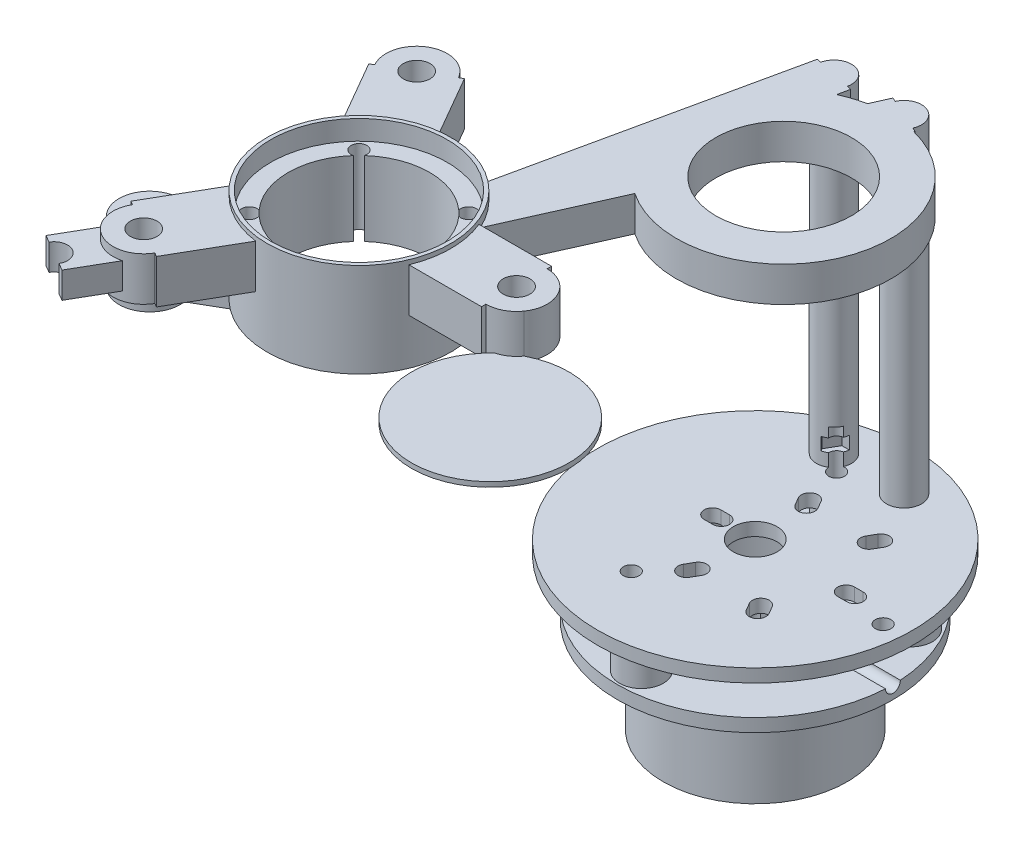
from build123d import *
from build123d.topology import SkipClean

# Parameters (mm, degrees)
CARRIER_INBOARD_FRAME_SKETCH_R              = 15.5
CARRIER_INBOARD_FRAME_SKETCH_R_2            = 3.050000001
CARRIER_INBOARD_FRAME_SKETCH_R_3            = 3.050000002
CARRIER_INBOARD_FRAME_SKETCH_R_4            = 3.049999999
CARRIER_INBOARD_FRAME_DEPTH                 = 4.5
CARRIER_START                               = -0.9
CARRIER_GUIDE_AND_PIVOT_FRAME_2_SKETCH_R    = 15.5
CARRIER_GUIDE_AND_PIVOT_FRAME_2_SKETCH_R_2  = 3.050000001
CARRIER_GUIDE_AND_PIVOT_FRAME_2_SKETCH_R_3  = 3.050000002
CARRIER_GUIDE_AND_PIVOT_FRAME_2_SKETCH_R_4  = 3.049999999
CARRIER_GUIDE_AND_PIVOT_FRAME_2_DEPTH       = 0.9
CARRIER_START_2                             = -0.1
CARRIER_GUIDE_AND_PIVOT_FRAME_3_SKETCH_R    = 15.5
CARRIER_GUIDE_AND_PIVOT_FRAME_3_SKETCH_R_2  = 3.050000001
CARRIER_GUIDE_AND_PIVOT_FRAME_3_SKETCH_R_3  = 3.050000002
CARRIER_GUIDE_AND_PIVOT_FRAME_3_SKETCH_R_4  = 3.049999999
CARRIER_GUIDE_AND_PIVOT_FRAME_3_DEPTH       = 0.1
CARRIER_START_3                             = -0.999999998
CARRIER_GUIDE_AND_PIVOT_FRAME_4_SKETCH_R    = 4
CARRIER_GUIDE_AND_PIVOT_FRAME_4_SKETCH_R_2  = 3.050000001
CARRIER_GUIDE_AND_PIVOT_FRAME_4_SKETCH_R_3  = 3.050000002
CARRIER_GUIDE_AND_PIVOT_FRAME_4_SKETCH_R_4  = 3.049999999
CARRIER_GUIDE_AND_PIVOT_FRAME_4_DEPTH       = 0.999999998
CARRIER_START_4                             = -0.010000002
CARRIER_GUIDE_AND_PIVOT_FRAME_5_SKETCH_R    = 4
CARRIER_GUIDE_AND_PIVOT_FRAME_5_SKETCH_R_2  = 21
CARRIER_GUIDE_AND_PIVOT_FRAME_5_SKETCH_R_3  = 18.000000001
CARRIER_GUIDE_AND_PIVOT_FRAME_5_DEPTH       = 0.010000002
CARRIER_START_5                             = -0.490000001
CARRIER_GUIDE_AND_PIVOT_FRAME_6_SKETCH_R    = 4
CARRIER_GUIDE_AND_PIVOT_FRAME_6_SKETCH_R_2  = 21
CARRIER_GUIDE_AND_PIVOT_FRAME_6_DEPTH       = 0.490000001
CARRIER_START_6                             = -2.999999998
CARRIER_GUIDE_AND_PIVOT_FRAME_7_SKETCH_R    = 4
CARRIER_GUIDE_AND_PIVOT_FRAME_7_SKETCH_R_2  = 21
CARRIER_GUIDE_AND_PIVOT_FRAME_7_SKETCH_R_3  = 3.1
CARRIER_GUIDE_AND_PIVOT_FRAME_7_DEPTH       = 2.999999998
CARRIER_GUIDE_AND_PIVOT_FRAME_8_SKETCH_R    = 4
CARRIER_GUIDE_AND_PIVOT_FRAME_8_SKETCH_R_2  = 21
CARRIER_GUIDE_AND_PIVOT_FRAME_8_DEPTH       = 2.500000001
CARRIER_GUIDE_AND_PIVOT_FRAME_9_SKETCH_R    = 4
CARRIER_GUIDE_AND_PIVOT_FRAME_9_DEPTH       = 4.5
CARRIER_GUIDE_AND_PIVOT_FRAME_10_SKETCH_R   = 4
CARRIER_GUIDE_AND_PIVOT_FRAME_10_DEPTH      = 1.000000001
CARRIER_GUIDE_AND_PIVOT_FRAME_11_SKETCH_R   = 4
CARRIER_GUIDE_AND_PIVOT_FRAME_11_SKETCH_R_2 = 3.1
CARRIER_GUIDE_AND_PIVOT_FRAME_11_DEPTH      = 0.5
CARRIER_GUIDE_AND_PIVOT_FRAME_12_SKETCH_R   = 4
CARRIER_GUIDE_AND_PIVOT_FRAME_12_SKETCH_R_2 = 3.1
CARRIER_GUIDE_AND_PIVOT_FRAME_12_DEPTH      = 2.499999999
CARRIER_WHEEL_SUPPORT_13_SKETCH_R           = 4
CARRIER_WHEEL_SUPPORT_13_DEPTH              = 43.5
CARRIER_WHEEL_SUPPORT_14_SKETCH_R           = 4
CARRIER_WHEEL_SUPPORT_14_DEPTH              = 2.2
CARRIER_WHEEL_SUPPORT_15_SKETCH_R           = 4
CARRIER_WHEEL_SUPPORT_15_DEPTH              = 2.9
CARRIER_WHEEL_SUPPORT_16_SKETCH_R           = 4
CARRIER_WHEEL_SUPPORT_16_DEPTH              = 2.9
CARRIER_WHEEL_SUPPORT_17_SKETCH_R           = 36
CARRIER_WHEEL_SUPPORT_17_SKETCH_R_2         = 1.8
CARRIER_WHEEL_SUPPORT_17_SKETCH_R_3         = 5
CARRIER_WHEEL_SUPPORT_17_DEPTH              = 3
CARRIER_WHEEL_SUPPORT_18_SKETCH_R           = 5
CARRIER_WHEEL_SUPPORT_18_SKETCH_R_2         = 4
CARRIER_WHEEL_SUPPORT_18_DEPTH              = 0.9
CARRIER_WHEEL_SUPPORT_19_SKETCH_R           = 5
CARRIER_WHEEL_SUPPORT_19_SKETCH_R_2         = 4
CARRIER_WHEEL_SUPPORT_19_DEPTH              = 1.5
CARRIER_WHEEL_SUPPORT_20_SKETCH_R           = 5
CARRIER_WHEEL_SUPPORT_20_SKETCH_R_2         = 4
CARRIER_WHEEL_SUPPORT_20_DEPTH              = 7.600000002
CARRIER_WHEEL_SUPPORT_21_SKETCH_R           = 31.5
CARRIER_WHEEL_SUPPORT_21_SKETCH_R_2         = 20.15
CARRIER_WHEEL_SUPPORT_21_DEPTH              = 2.999999998
CARRIER_WHEEL_SUPPORT_22_SKETCH_R           = 21
CARRIER_WHEEL_SUPPORT_22_SKETCH_R_2         = 20.15
CARRIER_WHEEL_SUPPORT_22_DEPTH              = 4.5
CARRIER_WHEEL_SUPPORT_23_SKETCH_R           = 21
CARRIER_WHEEL_SUPPORT_23_DEPTH              = 17
CARRIER_GUIDE_AND_PIVOT_FRAME_24_SKETCH_R   = 15.500000001
CARRIER_GUIDE_AND_PIVOT_FRAME_24_SKETCH_R_2 = 20.150000001
CARRIER_GUIDE_AND_PIVOT_FRAME_24_SKETCH_R_3 = 3.05
CARRIER_GUIDE_AND_PIVOT_FRAME_24_SKETCH_R_4 = 3.050000003
CARRIER_GUIDE_AND_PIVOT_FRAME_24_DEPTH      = 1.499999999
CARRIER_GUIDE_AND_PIVOT_FRAME_25_SKETCH_R   = 15.500000001
CARRIER_GUIDE_AND_PIVOT_FRAME_25_SKETCH_R_2 = 20.150000001
CARRIER_GUIDE_AND_PIVOT_FRAME_25_SKETCH_R_3 = 3.05
CARRIER_GUIDE_AND_PIVOT_FRAME_25_SKETCH_R_4 = 3.050000003
CARRIER_GUIDE_AND_PIVOT_FRAME_25_DEPTH      = 0.999999996
CARRIER_GUIDE_AND_PIVOT_FRAME_26_SKETCH_R   = 20.150000001
CARRIER_GUIDE_AND_PIVOT_FRAME_26_SKETCH_R_2 = 3.05
CARRIER_GUIDE_AND_PIVOT_FRAME_26_SKETCH_R_3 = 3.050000003
CARRIER_GUIDE_AND_PIVOT_FRAME_26_DEPTH      = 1.000000006
CARRIER_GUIDE_AND_PIVOT_FRAME_27_SKETCH_R   = 21
CARRIER_GUIDE_AND_PIVOT_FRAME_27_SKETCH_R_2 = 20.15
CARRIER_GUIDE_AND_PIVOT_FRAME_27_DEPTH      = 0.999999998
COUPLING_PIN_SERVICE_CHANNEL_SKETCH_R       = 1.7
COUPLING_PIN_SERVICE_CHANNEL_DEPTH          = 66


with BuildPart() as part:
    # Carrier Inboard Frame Sketch → Carrier Inboard Frame (new body)
    with BuildSketch(Plane(origin=(0, -132, 0), x_dir=(1, 0, 0), z_dir=(0, 1, 0))):
        with BuildLine():
            Line((-23.100614252, 78.394535152), (-22.123472094, 78.181948221))
            Line((-22.123472094, 78.181948221), (-22.701719693, 75.524070327))
            ThreePointArc((-22.701719693, 75.524070327), (-20.084271186, 76.544411569), (-17.367224839, 77.258408824))
            Line((-17.367224839, 77.258408824), (-15.576730603, 81.278969365))
            Line((-15.576730603, 81.278969365), (-14.663221052, 80.872152065))
            ThreePointArc((-14.663221052, 80.872152065), (-12.020207409, 83.115002954), (-8.617920583, 82.451417558))
            ThreePointArc((-8.617920583, 82.451417558), (-7.1390628, 80.255907409), (-7.355144702, 77.617613686))
            Line((-7.355144702, 77.617613686), (-6.441635164, 77.210796392))
            Line((-6.441635164, 77.210796392), (-6.533321658, 77.004914078))
            ThreePointArc((-6.533321658, 77.004914078), (9.87180094, 43.277859095), (-26.171286763, 32.907800552))
            Line((-26.171286763, 32.907800552), (-37.06497245, 8.445994462))
            ThreePointArc((-37.06497245, 8.445994462), (-36.968781126, 8.223544876), (-36.875163407, 8))
            Line((-36.875163407, 8), (-20.291651247, 8))
            Line((-20.291651247, 8), (-20.291651247, 7))
            ThreePointArc((-20.291651247, 7), (-14.084717769, 3.236352392), (-14.552272959, -4.007435199))
            Line((-14.552272959, -4.007435199), (-14.566573894, -4.027839286))
            ThreePointArc((-14.566573894, -4.027839286), (-17.066350873, -6.212683599), (-20.291651246, -7))
            Line((-20.291651246, -7), (-20.291651246, -8))
            Line((-20.291651246, -8), (-36.875163407, -8))
            ThreePointArc((-36.875163407, -8), (-44.6083298, -17.449928367), (-56.291651246, -21))
            ThreePointArc((-56.291651246, -21), (-57.684740236, -20.953741982), (-59.071691937, -20.815171721))
            Line((-59.071691937, -20.815171721), (-67.363448017, -35.176914536))
            Line((-67.363448017, -35.176914536), (-68.229473419, -34.676914537))
            ThreePointArc((-68.229473419, -34.676914537), (-70.002040821, -36.708572734), (-72.411013969, -37.919555224))
            Line((-72.411013969, -37.919555224), (-77.461524226, -46.667295594))
            Line((-77.461524226, -46.667295594), (-79.106972494, -45.717295594))
            ThreePointArc((-79.106972494, -45.717295594), (-80.241651245, -41.482616842), (-84.476329997, -42.617295594))
            Line((-84.476329997, -42.617295594), (-86.121778264, -41.667295594))
            Line((-86.121778264, -41.667295594), (-81.071268007, -32.919555224))
            ThreePointArc((-81.071268007, -32.919555224), (-81.227012981, -30.227832035), (-80.353829072, -27.676914537))
            Line((-80.353829072, -27.676914537), (-81.219854478, -27.176914536))
            Line((-81.219854478, -27.176914536), (-72.928098397, -12.815171719))
            ThreePointArc((-72.928098397, -12.815171719), (-77.291651246, 0), (-72.928098397, 12.815171719))
            Line((-72.928098397, 12.815171719), (-81.219854478, 27.176914536))
            Line((-81.219854478, 27.176914536), (-80.353829074, 27.676914536))
            ThreePointArc((-80.353829074, 27.676914536), (-77.791651247, 37.239092362), (-68.229473421, 34.676914535))
            Line((-68.229473421, 34.676914535), (-67.363448018, 35.176914535))
            Line((-67.363448018, 35.176914535), (-59.071691938, 20.81517172))
            ThreePointArc((-59.071691938, 20.81517172), (-52.021603008, 20.561291011), (-45.453402184, 17.987005233))
            Line((-45.453402184, 17.987005233), (-31.894893673, 80.307817537))
            Line((-31.894893673, 80.307817537), (-30.917751515, 80.095230605))
            ThreePointArc((-30.917751515, 80.095230605), (-29.450257235, 82.413661194), (-26.834136801, 83.241050902))
            ThreePointArc((-26.834136801, 83.241050902), (-23.840404568, 81.685957231), (-23.100614252, 78.394535152))
        make_face()
        with Locations((-12.509182883, 53.244882879)):
            Circle(CARRIER_INBOARD_FRAME_SKETCH_R, mode=Mode.SUBTRACT)
        with Locations((-20.291651247, 0)):
            Circle(CARRIER_INBOARD_FRAME_SKETCH_R_2, mode=Mode.SUBTRACT)
        with Locations((-74.291651248, 31.176914536)):
            Circle(CARRIER_INBOARD_FRAME_SKETCH_R_3, mode=Mode.SUBTRACT)
        with Locations((-74.291651245, -31.176914537)):
            Circle(CARRIER_INBOARD_FRAME_SKETCH_R_4, mode=Mode.SUBTRACT)
        with BuildLine():
            ThreePointArc((-68.31259652, -10.785146023), (-70.080233479, -13.788582233), (-67.076797269, -12.020945274))
            ThreePointArc((-67.076797269, -12.020945274), (-56.291651246, -16.15), (-45.506505223, -12.020945274))
            ThreePointArc((-45.506505223, -12.020945274), (-42.503069013, -13.788582233), (-44.270705972, -10.785146023))
            ThreePointArc((-44.270705972, -10.785146023), (-40.141651246, 0), (-44.270705972, 10.785146023))
            ThreePointArc((-44.270705972, 10.785146023), (-42.503069013, 13.788582233), (-45.506505223, 12.020945274))
            ThreePointArc((-45.506505223, 12.020945274), (-56.291651246, 16.15), (-67.076797269, 12.020945274))
            ThreePointArc((-67.076797269, 12.020945274), (-70.080233479, 13.788582233), (-68.31259652, 10.785146023))
            ThreePointArc((-68.31259652, 10.785146023), (-72.441651246, 0), (-68.31259652, -10.785146023))
        make_face(mode=Mode.SUBTRACT)
    extrude(amount=CARRIER_INBOARD_FRAME_DEPTH)

    # Carrier Guide and Pivot Frame 2 Sketch → Carrier Guide and Pivot Frame 2 (add)
    with BuildSketch(Plane(origin=(0, -132, 0), x_dir=(1, 0, 0), z_dir=(0, 1, 0)).offset(CARRIER_START)):
        with BuildLine():
            Line((-23.100614252, 78.394535152), (-22.123472094, 78.181948221))
            Line((-22.123472094, 78.181948221), (-22.701719693, 75.524070327))
            ThreePointArc((-22.701719693, 75.524070327), (-20.084271187, 76.544411569), (-17.367224839, 77.258408824))
            Line((-17.367224839, 77.258408824), (-15.576730603, 81.278969365))
            Line((-15.576730603, 81.278969365), (-14.663221052, 80.872152065))
            ThreePointArc((-14.663221052, 80.872152065), (-12.02020741, 83.115002954), (-8.617920583, 82.451417558))
            ThreePointArc((-8.617920583, 82.451417558), (-7.1390628, 80.255907409), (-7.355144702, 77.617613686))
            Line((-7.355144702, 77.617613686), (-6.441635164, 77.210796392))
            Line((-6.441635164, 77.210796392), (-6.533321658, 77.004914078))
            ThreePointArc((-6.533321658, 77.004914078), (9.87180094, 43.277859095), (-26.171286763, 32.907800552))
            Line((-26.171286763, 32.907800552), (-37.06497245, 8.445994462))
            ThreePointArc((-37.06497245, 8.445994462), (-36.968781126, 8.223544876), (-36.875163407, 8))
            Line((-36.875163407, 8), (-20.291651247, 8))
            Line((-20.291651247, 8), (-20.291651247, 7))
            ThreePointArc((-20.291651247, 7), (-14.084717769, 3.236352392), (-14.55227296, -4.007435199))
            Line((-14.55227296, -4.007435199), (-14.566573895, -4.027839286))
            ThreePointArc((-14.566573895, -4.027839286), (-17.066350873, -6.212683599), (-20.291651246, -7))
            Line((-20.291651246, -7), (-20.291651246, -8))
            Line((-20.291651246, -8), (-36.875163407, -8))
            ThreePointArc((-36.875163407, -8), (-44.6083298, -17.449928367), (-56.291651246, -21))
            ThreePointArc((-56.291651246, -21), (-57.684740236, -20.953741982), (-59.071691937, -20.815171721))
            Line((-59.071691937, -20.815171721), (-67.363448017, -35.176914536))
            Line((-67.363448017, -35.176914536), (-68.229473419, -34.676914537))
            ThreePointArc((-68.229473419, -34.676914537), (-70.002040821, -36.708572734), (-72.411013969, -37.919555224))
            ThreePointArc((-72.411013969, -37.919555224), (-79.823309442, -35.466524962), (-80.353829071, -27.676914537))
            Line((-80.353829071, -27.676914537), (-81.219854478, -27.176914536))
            Line((-81.219854478, -27.176914536), (-72.928098397, -12.815171719))
            ThreePointArc((-72.928098397, -12.815171719), (-77.291651246, 0), (-72.928098397, 12.815171719))
            Line((-72.928098397, 12.815171719), (-81.219854478, 27.176914536))
            Line((-81.219854478, 27.176914536), (-80.353829074, 27.676914536))
            ThreePointArc((-80.353829074, 27.676914536), (-77.791651247, 37.239092362), (-68.229473421, 34.676914536))
            Line((-68.229473421, 34.676914536), (-67.363448018, 35.176914535))
            Line((-67.363448018, 35.176914535), (-59.071691938, 20.81517172))
            ThreePointArc((-59.071691938, 20.81517172), (-52.021603008, 20.561291011), (-45.453402184, 17.987005233))
            Line((-45.453402184, 17.987005233), (-31.894893673, 80.307817537))
            Line((-31.894893673, 80.307817537), (-30.917751515, 80.095230605))
            ThreePointArc((-30.917751515, 80.095230605), (-29.450257235, 82.413661194), (-26.834136802, 83.241050902))
            ThreePointArc((-26.834136802, 83.241050902), (-23.840404569, 81.685957231), (-23.100614252, 78.394535152))
        make_face()
        with Locations((-12.509182883, 53.244882879)):
            Circle(CARRIER_GUIDE_AND_PIVOT_FRAME_2_SKETCH_R, mode=Mode.SUBTRACT)
        with Locations((-20.291651247, 0)):
            Circle(CARRIER_GUIDE_AND_PIVOT_FRAME_2_SKETCH_R_2, mode=Mode.SUBTRACT)
        with Locations((-74.291651248, 31.176914536)):
            Circle(CARRIER_GUIDE_AND_PIVOT_FRAME_2_SKETCH_R_3, mode=Mode.SUBTRACT)
        with Locations((-74.291651245, -31.176914537)):
            Circle(CARRIER_GUIDE_AND_PIVOT_FRAME_2_SKETCH_R_4, mode=Mode.SUBTRACT)
        with BuildLine():
            ThreePointArc((-68.31259652, -10.785146023), (-70.080233479, -13.788582233), (-67.076797269, -12.020945274))
            ThreePointArc((-67.076797269, -12.020945274), (-56.291651246, -16.15), (-45.506505223, -12.020945274))
            ThreePointArc((-45.506505223, -12.020945274), (-42.503069013, -13.788582233), (-44.270705972, -10.785146023))
            ThreePointArc((-44.270705972, -10.785146023), (-40.141651246, 0), (-44.270705972, 10.785146023))
            ThreePointArc((-44.270705972, 10.785146023), (-42.503069013, 13.788582233), (-45.506505223, 12.020945274))
            ThreePointArc((-45.506505223, 12.020945274), (-56.291651246, 16.15), (-67.076797269, 12.020945274))
            ThreePointArc((-67.076797269, 12.020945274), (-70.080233479, 13.788582233), (-68.31259652, 10.785146023))
            ThreePointArc((-68.31259652, 10.785146023), (-72.441651246, 0), (-68.31259652, -10.785146023))
        make_face(mode=Mode.SUBTRACT)
    extrude(amount=CARRIER_GUIDE_AND_PIVOT_FRAME_2_DEPTH)

    # Carrier Guide and Pivot Frame 3 Sketch → Carrier Guide and Pivot Frame 3 (add)
    with BuildSketch(Plane(origin=(0, -132.900000001, 0), x_dir=(1, 0, 0), z_dir=(0, 1, 0)).offset(CARRIER_START_2)):
        with BuildLine():
            Line((-23.100614253, 78.394535153), (-22.123472094, 78.181948221))
            Line((-22.123472094, 78.181948221), (-22.701719693, 75.524070327))
            ThreePointArc((-22.701719693, 75.524070327), (-20.084271187, 76.544411569), (-17.367224839, 77.258408824))
            Line((-17.367224839, 77.258408824), (-15.576730603, 81.278969365))
            Line((-15.576730603, 81.278969365), (-14.663221053, 80.872152065))
            ThreePointArc((-14.663221053, 80.872152065), (-12.02020741, 83.115002954), (-8.617920583, 82.451417558))
            ThreePointArc((-8.617920583, 82.451417558), (-7.1390628, 80.255907409), (-7.355144702, 77.617613686))
            Line((-7.355144702, 77.617613686), (-6.441635164, 77.210796392))
            Line((-6.441635164, 77.210796392), (-6.533321658, 77.004914078))
            ThreePointArc((-6.533321658, 77.004914078), (9.87180094, 43.277859095), (-26.171286763, 32.907800552))
            Line((-26.171286763, 32.907800552), (-37.06497245, 8.445994462))
            ThreePointArc((-37.06497245, 8.445994462), (-36.968781126, 8.223544876), (-36.875163407, 8))
            Line((-36.875163407, 8), (-20.291651247, 8))
            Line((-20.291651247, 8), (-20.291651247, 7))
            ThreePointArc((-20.291651247, 7), (-14.084717769, 3.236352392), (-14.55227296, -4.007435199))
            ThreePointArc((-14.55227296, -4.007435199), (4.030670954, -34.74617457), (-18.490761077, -6.764376882))
            ThreePointArc((-18.490761077, -6.764376882), (-19.383531808, -6.940844263), (-20.291651246, -7))
            Line((-20.291651246, -7), (-20.291651246, -8))
            Line((-20.291651246, -8), (-36.875163407, -8))
            ThreePointArc((-36.875163407, -8), (-44.6083298, -17.449928367), (-56.291651246, -21))
            ThreePointArc((-56.291651246, -21), (-57.684740236, -20.953741982), (-59.071691937, -20.815171721))
            Line((-59.071691937, -20.815171721), (-67.363448017, -35.176914536))
            Line((-67.363448017, -35.176914536), (-68.229473419, -34.676914537))
            ThreePointArc((-68.229473419, -34.676914537), (-70.002040821, -36.708572734), (-72.411013969, -37.919555224))
            ThreePointArc((-72.411013969, -37.919555224), (-79.823309442, -35.466524962), (-80.353829071, -27.676914537))
            Line((-80.353829071, -27.676914537), (-81.219854478, -27.176914536))
            Line((-81.219854478, -27.176914536), (-72.928098397, -12.815171719))
            ThreePointArc((-72.928098397, -12.815171719), (-77.291651246, 0), (-72.928098397, 12.815171719))
            Line((-72.928098397, 12.815171719), (-81.219854478, 27.176914536))
            Line((-81.219854478, 27.176914536), (-80.353829074, 27.676914536))
            ThreePointArc((-80.353829074, 27.676914536), (-77.791651247, 37.239092362), (-68.229473421, 34.676914536))
            Line((-68.229473421, 34.676914536), (-67.363448018, 35.176914535))
            Line((-67.363448018, 35.176914535), (-59.071691938, 20.81517172))
            ThreePointArc((-59.071691938, 20.81517172), (-52.021603008, 20.561291011), (-45.453402184, 17.987005233))
            Line((-45.453402184, 17.987005233), (-31.894893673, 80.307817537))
            Line((-31.894893673, 80.307817537), (-30.917751515, 80.095230605))
            ThreePointArc((-30.917751515, 80.095230605), (-29.450257235, 82.413661194), (-26.834136802, 83.241050902))
            ThreePointArc((-26.834136802, 83.241050902), (-23.840404569, 81.685957231), (-23.100614253, 78.394535153))
        make_face()
        with Locations((-12.509182883, 53.244882879)):
            Circle(CARRIER_GUIDE_AND_PIVOT_FRAME_3_SKETCH_R, mode=Mode.SUBTRACT)
        with Locations((-20.291651247, 0)):
            Circle(CARRIER_GUIDE_AND_PIVOT_FRAME_3_SKETCH_R_2, mode=Mode.SUBTRACT)
        with Locations((-74.291651248, 31.176914536)):
            Circle(CARRIER_GUIDE_AND_PIVOT_FRAME_3_SKETCH_R_3, mode=Mode.SUBTRACT)
        with Locations((-74.291651245, -31.176914537)):
            Circle(CARRIER_GUIDE_AND_PIVOT_FRAME_3_SKETCH_R_4, mode=Mode.SUBTRACT)
        with BuildLine():
            ThreePointArc((-68.31259652, -10.785146023), (-70.080233479, -13.788582233), (-67.076797269, -12.020945274))
            ThreePointArc((-67.076797269, -12.020945274), (-56.291651246, -16.15), (-45.506505223, -12.020945274))
            ThreePointArc((-45.506505223, -12.020945274), (-42.503069013, -13.788582233), (-44.270705972, -10.785146023))
            ThreePointArc((-44.270705972, -10.785146023), (-40.141651246, 0), (-44.270705972, 10.785146023))
            ThreePointArc((-44.270705972, 10.785146023), (-42.503069013, 13.788582233), (-45.506505223, 12.020945274))
            ThreePointArc((-45.506505223, 12.020945274), (-56.291651246, 16.15), (-67.076797269, 12.020945274))
            ThreePointArc((-67.076797269, 12.020945274), (-70.080233479, 13.788582233), (-68.31259652, 10.785146023))
            ThreePointArc((-68.31259652, 10.785146023), (-72.441651246, 0), (-68.31259652, -10.785146023))
        make_face(mode=Mode.SUBTRACT)
    extrude(amount=CARRIER_GUIDE_AND_PIVOT_FRAME_3_DEPTH)

    # Carrier Guide and Pivot Frame 4 Sketch → Carrier Guide and Pivot Frame 4 (add)
    # profile 1 of 3: a face of its own
    with BuildSketch(Plane(origin=(0, -133, 0), x_dir=(1, 0, 0), z_dir=(0, 1, 0)).offset(CARRIER_START_3)):
        with Locations((-27.009182884, 79.244882879)):
            Circle(CARRIER_GUIDE_AND_PIVOT_FRAME_4_SKETCH_R)
    # profile 2 of 3: a face of its own
    with BuildSketch(Plane(origin=(0, -133, 0), x_dir=(1, 0, 0), z_dir=(0, 1, 0)).offset(CARRIER_START_3)):
        with Locations((-11.009182876, 79.244882879)):
            Circle(CARRIER_GUIDE_AND_PIVOT_FRAME_4_SKETCH_R)
    # profile 3 of 3: a face of its own
    with BuildSketch(Plane(origin=(0, -133, 0), x_dir=(1, 0, 0), z_dir=(0, 1, 0)).offset(CARRIER_START_3)):
        with BuildLine():
            Line((-20.291651246, -8), (-36.875163407, -8))
            ThreePointArc((-36.875163407, -8), (-44.6083298, -17.449928367), (-56.291651246, -21))
            ThreePointArc((-56.291651246, -21), (-57.684740236, -20.953741982), (-59.071691937, -20.815171721))
            Line((-59.071691937, -20.815171721), (-67.363448017, -35.176914536))
            Line((-67.363448017, -35.176914536), (-68.229473419, -34.676914537))
            ThreePointArc((-68.229473419, -34.676914537), (-70.002040821, -36.708572734), (-72.411013969, -37.919555224))
            ThreePointArc((-72.411013969, -37.919555224), (-79.823309442, -35.466524962), (-80.353829071, -27.676914537))
            Line((-80.353829071, -27.676914537), (-81.219854478, -27.176914536))
            Line((-81.219854478, -27.176914536), (-72.928098397, -12.815171719))
            ThreePointArc((-72.928098397, -12.815171719), (-77.291651246, 0), (-72.928098397, 12.815171719))
            Line((-72.928098397, 12.815171719), (-81.219854478, 27.176914536))
            Line((-81.219854478, 27.176914536), (-80.353829074, 27.676914536))
            ThreePointArc((-80.353829074, 27.676914536), (-77.791651247, 37.239092362), (-68.229473421, 34.676914536))
            Line((-68.229473421, 34.676914536), (-67.363448018, 35.176914535))
            Line((-67.363448018, 35.176914535), (-59.071691938, 20.81517172))
            ThreePointArc((-59.071691938, 20.81517172), (-45.791651247, 18.18653348), (-36.875163407, 8))
            Line((-36.875163407, 8), (-20.291651247, 8))
            Line((-20.291651247, 8), (-20.291651247, 7))
            ThreePointArc((-20.291651247, 7), (-14.084717769, 3.236352392), (-14.55227296, -4.007435199))
            ThreePointArc((-14.55227296, -4.007435199), (4.030670954, -34.74617457), (-18.490761077, -6.764376882))
            ThreePointArc((-18.490761077, -6.764376882), (-19.383531808, -6.940844263), (-20.291651246, -7))
            Line((-20.291651246, -7), (-20.291651246, -8))
        make_face()
        with Locations((-20.291651247, 0)):
            Circle(CARRIER_GUIDE_AND_PIVOT_FRAME_4_SKETCH_R_2, mode=Mode.SUBTRACT)
        with Locations((-74.291651248, 31.176914536)):
            Circle(CARRIER_GUIDE_AND_PIVOT_FRAME_4_SKETCH_R_3, mode=Mode.SUBTRACT)
        with Locations((-74.291651245, -31.176914537)):
            Circle(CARRIER_GUIDE_AND_PIVOT_FRAME_4_SKETCH_R_4, mode=Mode.SUBTRACT)
        with BuildLine():
            ThreePointArc((-68.31259652, -10.785146023), (-70.080233479, -13.788582233), (-67.076797269, -12.020945274))
            ThreePointArc((-67.076797269, -12.020945274), (-56.291651246, -16.15), (-45.506505223, -12.020945274))
            ThreePointArc((-45.506505223, -12.020945274), (-42.503069013, -13.788582233), (-44.270705972, -10.785146023))
            ThreePointArc((-44.270705972, -10.785146023), (-40.141651246, 0), (-44.270705972, 10.785146023))
            ThreePointArc((-44.270705972, 10.785146023), (-42.503069013, 13.788582233), (-45.506505223, 12.020945274))
            ThreePointArc((-45.506505223, 12.020945274), (-56.291651246, 16.15), (-67.076797269, 12.020945274))
            ThreePointArc((-67.076797269, 12.020945274), (-70.080233479, 13.788582233), (-68.31259652, 10.785146023))
            ThreePointArc((-68.31259652, 10.785146023), (-72.441651246, 0), (-68.31259652, -10.785146023))
        make_face(mode=Mode.SUBTRACT)
    extrude(amount=CARRIER_GUIDE_AND_PIVOT_FRAME_4_DEPTH)

    # Carrier Guide and Pivot Frame 5 Sketch → Carrier Guide and Pivot Frame 5 (add)
    # profile 1 of 4: a face of its own
    with BuildSketch(Plane(origin=(0, -133.999999999, 0), x_dir=(1, 0, 0), z_dir=(0, 1, 0)).offset(CARRIER_START_4)):
        with Locations((-27.009182884, 79.244882879)):
            Circle(CARRIER_GUIDE_AND_PIVOT_FRAME_5_SKETCH_R)
    # profile 2 of 4: a face of its own
    with BuildSketch(Plane(origin=(0, -133.999999999, 0), x_dir=(1, 0, 0), z_dir=(0, 1, 0)).offset(CARRIER_START_4)):
        with Locations((-11.009182876, 79.244882879)):
            Circle(CARRIER_GUIDE_AND_PIVOT_FRAME_5_SKETCH_R)
    # profile 3 of 4: a face of its own
    with BuildSketch(Plane(origin=(0, -133.999999999, 0), x_dir=(1, 0, 0), z_dir=(0, 1, 0)).offset(CARRIER_START_4)):
        with Locations((-56.291651246, 0)):
            Circle(CARRIER_GUIDE_AND_PIVOT_FRAME_5_SKETCH_R_2)
        with BuildLine():
            ThreePointArc((-68.31259652, -10.785146023), (-70.080233479, -13.788582233), (-67.076797269, -12.020945274))
            ThreePointArc((-67.076797269, -12.020945274), (-56.291651246, -16.15), (-45.506505223, -12.020945274))
            ThreePointArc((-45.506505223, -12.020945274), (-42.503069013, -13.788582233), (-44.270705972, -10.785146023))
            ThreePointArc((-44.270705972, -10.785146023), (-40.141651246, 0), (-44.270705972, 10.785146023))
            ThreePointArc((-44.270705972, 10.785146023), (-42.503069013, 13.788582233), (-45.506505223, 12.020945274))
            ThreePointArc((-45.506505223, 12.020945274), (-56.291651246, 16.15), (-67.076797269, 12.020945274))
            ThreePointArc((-67.076797269, 12.020945274), (-70.080233479, 13.788582233), (-68.31259652, 10.785146023))
            ThreePointArc((-68.31259652, 10.785146023), (-72.441651246, 0), (-68.31259652, -10.785146023))
        make_face(mode=Mode.SUBTRACT)
    # profile 4 of 4: a face of its own
    with BuildSketch(Plane(origin=(0, -133.999999999, 0), x_dir=(1, 0, 0), z_dir=(0, 1, 0)).offset(CARRIER_START_4)):
        with Locations((-6.291651246, -20)):
            Circle(CARRIER_GUIDE_AND_PIVOT_FRAME_5_SKETCH_R_3)
    extrude(amount=CARRIER_GUIDE_AND_PIVOT_FRAME_5_DEPTH)

    # Carrier Guide and Pivot Frame 6 Sketch → Carrier Guide and Pivot Frame 6 (add)
    # profile 1 of 3: a face of its own
    with BuildSketch(Plane(origin=(0, -134.010000001, 0), x_dir=(1, 0, 0), z_dir=(0, 1, 0)).offset(CARRIER_START_5)):
        with Locations((-27.009182884, 79.244882879)):
            Circle(CARRIER_GUIDE_AND_PIVOT_FRAME_6_SKETCH_R)
    # profile 2 of 3: a face of its own
    with BuildSketch(Plane(origin=(0, -134.010000001, 0), x_dir=(1, 0, 0), z_dir=(0, 1, 0)).offset(CARRIER_START_5)):
        with Locations((-11.009182876, 79.244882879)):
            Circle(CARRIER_GUIDE_AND_PIVOT_FRAME_6_SKETCH_R)
    # profile 3 of 3: a face of its own
    with BuildSketch(Plane(origin=(0, -134.010000001, 0), x_dir=(1, 0, 0), z_dir=(0, 1, 0)).offset(CARRIER_START_5)):
        with Locations((-56.291651246, 0)):
            Circle(CARRIER_GUIDE_AND_PIVOT_FRAME_6_SKETCH_R_2)
        with BuildLine():
            ThreePointArc((-68.31259652, -10.785146023), (-70.080233479, -13.788582233), (-67.076797269, -12.020945274))
            ThreePointArc((-67.076797269, -12.020945274), (-56.291651246, -16.15), (-45.506505223, -12.020945274))
            ThreePointArc((-45.506505223, -12.020945274), (-42.503069013, -13.788582233), (-44.270705972, -10.785146023))
            ThreePointArc((-44.270705972, -10.785146023), (-40.141651246, 0), (-44.270705972, 10.785146023))
            ThreePointArc((-44.270705972, 10.785146023), (-42.503069013, 13.788582233), (-45.506505223, 12.020945274))
            ThreePointArc((-45.506505223, 12.020945274), (-56.291651246, 16.15), (-67.076797269, 12.020945274))
            ThreePointArc((-67.076797269, 12.020945274), (-70.080233479, 13.788582233), (-68.31259652, 10.785146023))
            ThreePointArc((-68.31259652, 10.785146023), (-72.441651246, 0), (-68.31259652, -10.785146023))
        make_face(mode=Mode.SUBTRACT)
    extrude(amount=CARRIER_GUIDE_AND_PIVOT_FRAME_6_DEPTH)

    # Carrier Guide and Pivot Frame 7 Sketch → Carrier Guide and Pivot Frame 7 (add)
    # profile 1 of 4: a face of its own
    with BuildSketch(Plane(origin=(0, -134.500000002, 0), x_dir=(1, 0, 0), z_dir=(0, 1, 0)).offset(CARRIER_START_6)):
        with Locations((-27.009182884, 79.244882879)):
            Circle(CARRIER_GUIDE_AND_PIVOT_FRAME_7_SKETCH_R)
    # profile 2 of 4: a face of its own
    with BuildSketch(Plane(origin=(0, -134.500000002, 0), x_dir=(1, 0, 0), z_dir=(0, 1, 0)).offset(CARRIER_START_6)):
        with Locations((-11.009182876, 79.244882879)):
            Circle(CARRIER_GUIDE_AND_PIVOT_FRAME_7_SKETCH_R)
    # profile 3 of 4: a face of its own
    with BuildSketch(Plane(origin=(0, -134.500000002, 0), x_dir=(1, 0, 0), z_dir=(0, 1, 0)).offset(CARRIER_START_6)):
        with Locations((-56.291651246, 0)):
            Circle(CARRIER_GUIDE_AND_PIVOT_FRAME_7_SKETCH_R_2)
        with BuildLine():
            ThreePointArc((-68.31259652, -10.785146023), (-70.080233479, -13.788582233), (-67.076797269, -12.020945274))
            ThreePointArc((-67.076797269, -12.020945274), (-56.291651246, -16.15), (-45.506505223, -12.020945274))
            ThreePointArc((-45.506505223, -12.020945274), (-42.503069013, -13.788582233), (-44.270705972, -10.785146023))
            ThreePointArc((-44.270705972, -10.785146023), (-40.141651246, 0), (-44.270705972, 10.785146023))
            ThreePointArc((-44.270705972, 10.785146023), (-42.503069013, 13.788582233), (-45.506505223, 12.020945274))
            ThreePointArc((-45.506505223, 12.020945274), (-56.291651246, 16.15), (-67.076797269, 12.020945274))
            ThreePointArc((-67.076797269, 12.020945274), (-70.080233479, 13.788582233), (-68.31259652, 10.785146023))
            ThreePointArc((-68.31259652, 10.785146023), (-72.441651246, 0), (-68.31259652, -10.785146023))
        make_face(mode=Mode.SUBTRACT)
    # profile 4 of 4: a face of its own
    with BuildSketch(Plane(origin=(0, -134.500000002, 0), x_dir=(1, 0, 0), z_dir=(0, 1, 0)).offset(CARRIER_START_6)):
        with BuildLine():
            ThreePointArc((-80.877463026, -21.527839286), (-92.534816728, -13.784075176), (-80.480041275, -20.893376598))
            ThreePointArc((-80.480041275, -20.893376598), (-80.670264028, -21.215924826), (-80.877463026, -21.527839286))
        make_face()
        with Locations((-86.602540378, -17.500000001)):
            Circle(CARRIER_GUIDE_AND_PIVOT_FRAME_7_SKETCH_R_3, mode=Mode.SUBTRACT)
    extrude(amount=CARRIER_GUIDE_AND_PIVOT_FRAME_7_DEPTH)


with BuildPart() as carrier_guide_and_pivot_frame_7_piece_1:
    # of the separate pieces the step leaves, piece 1, a body of its own (carrier_guide_and_pivot_frame_7_pieces)
    add(part.part.solids().sort_by_distance((-45.453402184, -132, -17.987005233))[0])

    # Carrier Guide and Pivot Frame 8 Sketch → Carrier Guide and Pivot Frame 8 (add)
    # profile 1 of 4: a face of its own
    with BuildSketch(Plane(origin=(0, -137.5, 0), x_dir=(1, 0, 0), z_dir=(0, 1, 0))):
        with Locations((-27.009182884, 79.244882879)):
            Circle(CARRIER_GUIDE_AND_PIVOT_FRAME_8_SKETCH_R)
    # profile 2 of 4: a face of its own
    with BuildSketch(Plane(origin=(0, -137.5, 0), x_dir=(1, 0, 0), z_dir=(0, 1, 0))):
        with Locations((-11.009182876, 79.244882879)):
            Circle(CARRIER_GUIDE_AND_PIVOT_FRAME_8_SKETCH_R)
    # profile 3 of 4: a face of its own
    with BuildSketch(Plane(origin=(0, -137.5, 0), x_dir=(1, 0, 0), z_dir=(0, 1, 0))):
        with Locations((-56.291651246, 0)):
            Circle(CARRIER_GUIDE_AND_PIVOT_FRAME_8_SKETCH_R_2)
        with BuildLine():
            ThreePointArc((-68.31259652, -10.785146023), (-70.080233479, -13.788582233), (-67.076797269, -12.020945274))
            ThreePointArc((-67.076797269, -12.020945274), (-56.291651246, -16.15), (-45.506505223, -12.020945274))
            ThreePointArc((-45.506505223, -12.020945274), (-42.503069013, -13.788582233), (-44.270705972, -10.785146023))
            ThreePointArc((-44.270705972, -10.785146023), (-40.141651246, 0), (-44.270705972, 10.785146023))
            ThreePointArc((-44.270705972, 10.785146023), (-42.503069013, 13.788582233), (-45.506505223, 12.020945274))
            ThreePointArc((-45.506505223, 12.020945274), (-56.291651246, 16.15), (-67.076797269, 12.020945274))
            ThreePointArc((-67.076797269, 12.020945274), (-70.080233479, 13.788582233), (-68.31259652, 10.785146023))
            ThreePointArc((-68.31259652, 10.785146023), (-72.441651246, 0), (-68.31259652, -10.785146023))
        make_face(mode=Mode.SUBTRACT)
    # profile 4 of 4: a face of its own
    with BuildSketch(Plane(origin=(0, -137.5, 0), x_dir=(1, 0, 0), z_dir=(0, 1, 0))):
        with BuildLine():
            Line((-79.855563295, -19.365020168), (-81.398299852, -18.191650588))
            ThreePointArc((-81.398299852, -18.191650588), (-89.103213885, -12.883818462), (-88.86596326, -22.237026162))
            Line((-88.86596326, -22.237026162), (-88.725821636, -24.170208145))
            ThreePointArc((-88.725821636, -24.170208145), (-89.936771721, -11.345091282), (-79.855563295, -19.365020168))
        make_face()
    extrude(amount=-CARRIER_GUIDE_AND_PIVOT_FRAME_8_DEPTH)


with BuildPart() as carrier_guide_and_pivot_frame_7_piece_2:
    # of the separate pieces the step leaves, piece 2, a body of its own (carrier_guide_and_pivot_frame_7_pieces)
    add(part.part.solids().sort_by_distance((-80.480041275, -137.5, 20.893376598))[0])


with BuildPart() as carrier_guide_and_pivot_frame_8_piece_1:
    # of the separate pieces the step leaves, piece 1, a body of its own (carrier_guide_and_pivot_frame_8_pieces)
    add(carrier_guide_and_pivot_frame_7_piece_1.part.solids().sort_by_distance((-45.453402184, -132, -17.987005233))[0])

    # Carrier Guide and Pivot Frame 9 Sketch → Carrier Guide and Pivot Frame 9 (add)
    # profile 1 of 3: a face of its own
    with BuildSketch(Plane(origin=(0, -140, 0), x_dir=(1, 0, 0), z_dir=(0, 1, 0))):
        with Locations((-27.009182885, 79.244882879)):
            Circle(CARRIER_GUIDE_AND_PIVOT_FRAME_9_SKETCH_R)
    # profile 2 of 3: a face of its own
    with BuildSketch(Plane(origin=(0, -140, 0), x_dir=(1, 0, 0), z_dir=(0, 1, 0))):
        with Locations((-11.009182877, 79.244882879)):
            Circle(CARRIER_GUIDE_AND_PIVOT_FRAME_9_SKETCH_R)
    # profile 3 of 3: a face of its own
    with BuildSketch(Plane(origin=(0, -140, 0), x_dir=(1, 0, 0), z_dir=(0, 1, 0))):
        with BuildLine():
            Line((-86.480041404, -10.501071941), (-76.720076308, -4.866153466))
            ThreePointArc((-76.720076308, -4.866153466), (-43.276068719, 16.480127776), (-56.291651249, -20.999999997))
            ThreePointArc((-56.291651249, -20.999999997), (-64.056069295, -19.511888999), (-70.720076304, -15.258458321))
            Line((-70.720076304, -15.258458321), (-78.982709995, -20.028892107))
            Line((-78.982709995, -20.028892107), (-81.398299852, -18.191650588))
            ThreePointArc((-81.398299852, -18.191650588), (-89.103213886, -12.883818462), (-88.86596326, -22.237026162))
            Line((-88.86596326, -22.237026162), (-88.725821637, -24.170208145))
            ThreePointArc((-88.725821637, -24.170208145), (-93.509935226, -16.365144764), (-86.480041404, -10.501071941))
        make_face()
        with BuildLine():
            ThreePointArc((-68.312596522, -10.78514602), (-70.080233482, -13.78858223), (-67.076797271, -12.020945271))
            ThreePointArc((-67.076797271, -12.020945271), (-56.291651249, -16.149999997), (-45.506505226, -12.020945271))
            ThreePointArc((-45.506505226, -12.020945271), (-42.503069016, -13.78858223), (-44.270705975, -10.78514602))
            ThreePointArc((-44.270705975, -10.78514602), (-40.141651249, 3e-09), (-44.270705975, 10.785146025))
            ThreePointArc((-44.270705975, 10.785146025), (-42.503069016, 13.788582236), (-45.506505226, 12.020945276))
            ThreePointArc((-45.506505226, 12.020945276), (-56.291651249, 16.150000003), (-67.076797271, 12.020945276))
            ThreePointArc((-67.076797271, 12.020945276), (-70.080233482, 13.788582236), (-68.312596522, 10.785146025))
            ThreePointArc((-68.312596522, 10.785146025), (-72.441651249, 3e-09), (-68.312596522, -10.78514602))
        make_face(mode=Mode.SUBTRACT)
    extrude(amount=-CARRIER_GUIDE_AND_PIVOT_FRAME_9_DEPTH)

    # Carrier Guide and Pivot Frame 10 Sketch → Carrier Guide and Pivot Frame 10 (add)
    with BuildSketch(Plane(origin=(0, -144.5, 0), x_dir=(1, 0, 0), z_dir=(0, 1, 0))):
        with Locations((-27.009182885, 79.244882879)):
            Circle(CARRIER_GUIDE_AND_PIVOT_FRAME_10_SKETCH_R)
        with Locations((-11.009182877, 79.244882879)):
            Circle(CARRIER_GUIDE_AND_PIVOT_FRAME_10_SKETCH_R)
        with BuildLine():
            Line((-70.086516533, -14.892672416), (-78.982709996, -20.028892107))
            Line((-78.982709996, -20.028892107), (-81.398299852, -18.191650588))
            ThreePointArc((-81.398299852, -18.191650588), (-89.103213886, -12.883818462), (-88.86596326, -22.237026162))
            Line((-88.86596326, -22.237026162), (-88.725821637, -24.170208145))
            ThreePointArc((-88.725821637, -24.170208145), (-93.509935226, -16.365144764), (-86.480041404, -10.501071941))
            Line((-86.480041404, -10.501071941), (-76.086516537, -4.500367561))
            ThreePointArc((-76.086516537, -4.500367561), (-73.871966947, -10.149999995), (-70.086516533, -14.892672416))
        make_face()
    extrude(amount=-CARRIER_GUIDE_AND_PIVOT_FRAME_10_DEPTH)

    # Carrier Guide and Pivot Frame 11 Sketch → Carrier Guide and Pivot Frame 11 (add)
    # profile 1 of 3: a face of its own
    with BuildSketch(Plane(origin=(0, -145.500000001, 0), x_dir=(1, 0, 0), z_dir=(0, 1, 0))):
        with Locations((-27.009182885, 79.244882879)):
            Circle(CARRIER_GUIDE_AND_PIVOT_FRAME_11_SKETCH_R)
    # profile 2 of 3: a face of its own
    with BuildSketch(Plane(origin=(0, -145.500000001, 0), x_dir=(1, 0, 0), z_dir=(0, 1, 0))):
        with Locations((-11.009182877, 79.244882879)):
            Circle(CARRIER_GUIDE_AND_PIVOT_FRAME_11_SKETCH_R)
    # profile 3 of 3: a face of its own
    with BuildSketch(Plane(origin=(0, -145.500000001, 0), x_dir=(1, 0, 0), z_dir=(0, 1, 0))):
        with BuildLine():
            Line((-70.086516533, -14.892672417), (-80.480041379, -20.893376784))
            ThreePointArc((-80.480041379, -20.893376784), (-80.670264085, -21.215924916), (-80.877463026, -21.527839286))
            ThreePointArc((-80.877463026, -21.527839286), (-92.843208353, -20.670814289), (-86.480041403, -10.501071941))
            Line((-86.480041403, -10.501071941), (-76.086516538, -4.500367562))
            ThreePointArc((-76.086516538, -4.500367562), (-73.871966947, -10.149999996), (-70.086516533, -14.892672417))
        make_face()
        with Locations((-86.602540379, -17.500000001)):
            Circle(CARRIER_GUIDE_AND_PIVOT_FRAME_11_SKETCH_R_2, mode=Mode.SUBTRACT)
    extrude(amount=-CARRIER_GUIDE_AND_PIVOT_FRAME_11_DEPTH)

    # Carrier Guide and Pivot Frame 12 Sketch → Carrier Guide and Pivot Frame 12 (add)
    # profile 1 of 3: a face of its own
    with BuildSketch(Plane(origin=(0, -146.000000001, 0), x_dir=(1, 0, 0), z_dir=(0, 1, 0))):
        with Locations((-27.009182885, 79.244882879)):
            Circle(CARRIER_GUIDE_AND_PIVOT_FRAME_12_SKETCH_R)
    # profile 2 of 3: a face of its own
    with BuildSketch(Plane(origin=(0, -146.000000001, 0), x_dir=(1, 0, 0), z_dir=(0, 1, 0))):
        with Locations((-11.009182877, 79.244882879)):
            Circle(CARRIER_GUIDE_AND_PIVOT_FRAME_12_SKETCH_R)
    # profile 3 of 3: a face of its own
    with BuildSketch(Plane(origin=(0, -146.000000001, 0), x_dir=(1, 0, 0), z_dir=(0, 1, 0))):
        with BuildLine():
            ThreePointArc((-80.480041276, -20.893376598), (-80.670264029, -21.215924826), (-80.877463027, -21.527839286))
            ThreePointArc((-80.877463027, -21.527839286), (-92.534816729, -13.784075177), (-80.480041276, -20.893376598))
        make_face()
        with Locations((-86.602540379, -17.500000001)):
            Circle(CARRIER_GUIDE_AND_PIVOT_FRAME_12_SKETCH_R_2, mode=Mode.SUBTRACT)
    extrude(amount=-CARRIER_GUIDE_AND_PIVOT_FRAME_12_DEPTH)

    # Carrier Wheel Support 13 Sketch → Carrier Wheel Support 13 (add)
    with BuildSketch(Plane(origin=(0, -148.5, 0), x_dir=(1, 0, 0), z_dir=(0, 1, 0))):
        with Locations((-27.009182887, 79.244882879)):
            Circle(CARRIER_WHEEL_SUPPORT_13_SKETCH_R)
        with Locations((-11.009182879, 79.244882879)):
            Circle(CARRIER_WHEEL_SUPPORT_13_SKETCH_R)
    extrude(amount=-CARRIER_WHEEL_SUPPORT_13_DEPTH)

    # Carrier Wheel Support 14 Sketch → Carrier Wheel Support 14 (add)
    with BuildSketch(Plane(origin=(0, -192, 0), x_dir=(1, 0, 0), z_dir=(0, 1, 0))):
        with Locations((-11.009182881, 79.244882879)):
            Circle(CARRIER_WHEEL_SUPPORT_14_SKETCH_R)
        with BuildLine():
            ThreePointArc((-26.834136807, 83.241050902), (-23.626988582, 81.380476863), (-23.325892624, 77.684955694))
            ThreePointArc((-23.325892624, 77.684955694), (-24.446483989, 77.067928358), (-24.874188954, 75.862309761))
            ThreePointArc((-24.874188954, 75.862309761), (-30.875127331, 78.218007242), (-26.834136807, 83.241050902))
        make_face()
    extrude(amount=-CARRIER_WHEEL_SUPPORT_14_DEPTH)

    # Carrier Wheel Support 15 Sketch → Carrier Wheel Support 15 (add)
    with BuildSketch(Plane(origin=(0, -194.2, 0), x_dir=(1, 0, 0), z_dir=(0, 1, 0))):
        with Locations((-11.009182882, 79.244882879)):
            Circle(CARRIER_WHEEL_SUPPORT_15_SKETCH_R)
        with BuildLine():
            Line((-24.724639427, 78.760461387), (-23.038624261, 78.760461387))
            ThreePointArc((-23.038624261, 78.760461387), (-23.95706392, 81.830336378), (-26.834136808, 83.241050901))
            ThreePointArc((-26.834136808, 83.241050901), (-30.99006713, 78.854292733), (-26.060772664, 75.358944376))
            Line((-26.060772664, 75.358944376), (-26.374639427, 75.902577555))
            Line((-26.374639427, 75.902577555), (-24.724639427, 78.760461387))
        make_face()
    extrude(amount=-CARRIER_WHEEL_SUPPORT_15_DEPTH)

    # Carrier Wheel Support 16 Sketch → Carrier Wheel Support 16 (add)
    with BuildSketch(Plane(origin=(0, -197.1, 0), x_dir=(1, 0, 0), z_dir=(0, 1, 0))):
        with Locations((-11.009182882, 79.244882879)):
            Circle(CARRIER_WHEEL_SUPPORT_16_SKETCH_R)
        with BuildLine():
            ThreePointArc((-26.834136808, 83.241050902), (-23.626988582, 81.380476863), (-23.325892625, 77.684955694))
            ThreePointArc((-23.325892625, 77.684955694), (-24.446483989, 77.067928358), (-24.874188954, 75.862309761))
            ThreePointArc((-24.874188954, 75.862309761), (-30.875127331, 78.218007242), (-26.834136808, 83.241050902))
        make_face()
    extrude(amount=-CARRIER_WHEEL_SUPPORT_16_DEPTH)

    # Carrier Wheel Support 17 Sketch → Carrier Wheel Support 17 (add)
    with BuildSketch(Plane(origin=(0, -200, 0), x_dir=(1, 0, 0), z_dir=(0, 1, 0))):
        with Locations((-19.009182883, 53.244882879)):
            Circle(CARRIER_WHEEL_SUPPORT_17_SKETCH_R)
        with Locations((-23.074639427, 75.902577555)):
            Circle(CARRIER_WHEEL_SUPPORT_17_SKETCH_R_2, mode=Mode.SUBTRACT)
        with Locations((-26.848593792, 32.766081772)):
            Circle(CARRIER_WHEEL_SUPPORT_17_SKETCH_R_2, mode=Mode.SUBTRACT)
        with Locations((-19.009182883, 53.244882879)):
            Circle(CARRIER_WHEEL_SUPPORT_17_SKETCH_R_3, mode=Mode.SUBTRACT)
        with Locations((12.395684569, 51.06598931)):
            Circle(CARRIER_WHEEL_SUPPORT_17_SKETCH_R_2, mode=Mode.SUBTRACT)
        with BuildLine():
            Line((-21.28713115, 64.648735264), (-22.28713115, 66.380786071))
            ThreePointArc((-22.28713115, 66.380786071), (-21.591682883, 68.976234339), (-18.996234616, 68.280786071))
            Line((-18.996234616, 68.280786071), (-17.996234616, 66.548735264))
            ThreePointArc((-17.996234616, 66.548735264), (-18.691682883, 63.953286997), (-21.28713115, 64.648735264))
        make_face(mode=Mode.SUBTRACT)
        with BuildLine():
            Line((-26.774182883, 51.344882879), (-28.774182883, 51.344882879))
            ThreePointArc((-28.774182883, 51.344882879), (-30.674182883, 53.244882879), (-28.774182883, 55.144882879))
            Line((-28.774182883, 55.144882879), (-26.774182883, 55.144882879))
            ThreePointArc((-26.774182883, 55.144882879), (-24.874182883, 53.244882879), (-26.774182883, 51.344882879))
        make_face(mode=Mode.SUBTRACT)
        with BuildLine():
            Line((-17.996234616, 39.941030494), (-18.996234616, 38.208979686))
            ThreePointArc((-18.996234616, 38.208979686), (-21.591682883, 37.513531419), (-22.28713115, 40.108979686))
            Line((-22.28713115, 40.108979686), (-21.28713115, 41.841030494))
            ThreePointArc((-21.28713115, 41.841030494), (-18.691682883, 42.536478761), (-17.996234616, 39.941030494))
        make_face(mode=Mode.SUBTRACT)
        with BuildLine():
            Line((-7.02213115, 66.548735264), (-6.02213115, 68.280786071))
            ThreePointArc((-6.02213115, 68.280786071), (-3.426682883, 68.976234339), (-2.731234616, 66.380786071))
            Line((-2.731234616, 66.380786071), (-3.731234616, 64.648735264))
            ThreePointArc((-3.731234616, 64.648735264), (-6.326682883, 63.953286997), (-7.02213115, 66.548735264))
        make_face(mode=Mode.SUBTRACT)
        with BuildLine():
            Line((1.755817117, 55.144882879), (3.755817117, 55.144882879))
            ThreePointArc((3.755817117, 55.144882879), (5.655817117, 53.244882879), (3.755817117, 51.344882879))
            Line((3.755817117, 51.344882879), (1.755817117, 51.344882879))
            ThreePointArc((1.755817117, 51.344882879), (-0.144182883, 53.244882879), (1.755817117, 55.144882879))
        make_face(mode=Mode.SUBTRACT)
        with BuildLine():
            Line((-3.731234616, 41.841030494), (-2.731234616, 40.108979686))
            ThreePointArc((-2.731234616, 40.108979686), (-3.426682883, 37.513531419), (-6.02213115, 38.208979686))
            Line((-6.02213115, 38.208979686), (-7.02213115, 39.941030494))
            ThreePointArc((-7.02213115, 39.941030494), (-6.326682883, 42.536478761), (-3.731234616, 41.841030494))
        make_face(mode=Mode.SUBTRACT)
    extrude(amount=-CARRIER_WHEEL_SUPPORT_17_DEPTH)

    # Carrier Wheel Support 18 Sketch → Carrier Wheel Support 18 (add)
    with BuildSketch(Plane(origin=(0, -203, 0), x_dir=(1, 0, 0), z_dir=(0, 1, 0))):
        with Locations((-41.525843382, 66.244882879)):
            Circle(CARRIER_WHEEL_SUPPORT_18_SKETCH_R)
        with Locations((-19.009182883, 27.244882879)):
            Circle(CARRIER_WHEEL_SUPPORT_18_SKETCH_R)
        with Locations((-11.009182882, 79.244882879)):
            Circle(CARRIER_WHEEL_SUPPORT_18_SKETCH_R_2)
        with BuildLine():
            ThreePointArc((-23.011737101, 79.10195926), (-25.513474205, 77.974312316), (-26.22174457, 75.323156104))
            ThreePointArc((-26.22174457, 75.323156104), (-30.997272478, 78.936432821), (-26.834136808, 83.241050902))
            ThreePointArc((-26.834136808, 83.241050902), (-24.070570631, 81.958654791), (-23.011737101, 79.10195926))
        make_face()
        with BuildLine():
            ThreePointArc((3.507477615, 61.244882879), (7.466480874, 69.298780912), (-1.328679291, 67.514365599))
            ThreePointArc((-1.328679291, 67.514365599), (-1.177954603, 66.367760116), (-1.388571099, 65.230630942))
            ThreePointArc((-1.388571099, 65.230630942), (0.350838555, 62.367302468), (3.507477615, 61.244882879))
        make_face()
    extrude(amount=-CARRIER_WHEEL_SUPPORT_18_DEPTH)

    # Carrier Wheel Support 19 Sketch → Carrier Wheel Support 19 (add)
    with BuildSketch(Plane(origin=(0, -203.9, 0), x_dir=(1, 0, 0), z_dir=(0, 1, 0))):
        with Locations((-41.525843382, 66.244882879)):
            Circle(CARRIER_WHEEL_SUPPORT_19_SKETCH_R)
        with Locations((-19.009182883, 27.244882879)):
            Circle(CARRIER_WHEEL_SUPPORT_19_SKETCH_R)
        with Locations((-11.009182882, 79.244882879)):
            Circle(CARRIER_WHEEL_SUPPORT_19_SKETCH_R_2)
        with Locations((3.507477615, 66.244882879)):
            Circle(CARRIER_WHEEL_SUPPORT_19_SKETCH_R)
        with BuildLine():
            ThreePointArc((-23.011737101, 79.10195926), (-25.513474205, 77.974312316), (-26.22174457, 75.323156104))
            ThreePointArc((-26.22174457, 75.323156104), (-30.997272478, 78.936432821), (-26.834136808, 83.241050902))
            ThreePointArc((-26.834136808, 83.241050902), (-24.070570631, 81.958654791), (-23.011737101, 79.10195926))
        make_face()
    extrude(amount=-CARRIER_WHEEL_SUPPORT_19_DEPTH)

    # Carrier Wheel Support 20 Sketch → Carrier Wheel Support 20 (add)
    with BuildSketch(Plane(origin=(0, -205.4, 0), x_dir=(1, 0, 0), z_dir=(0, 1, 0))):
        with Locations((-41.525843382, 66.244882879)):
            Circle(CARRIER_WHEEL_SUPPORT_20_SKETCH_R)
        with Locations((-27.009182891, 79.244882879)):
            Circle(CARRIER_WHEEL_SUPPORT_20_SKETCH_R_2)
        with Locations((-19.009182883, 27.244882879)):
            Circle(CARRIER_WHEEL_SUPPORT_20_SKETCH_R)
        with Locations((-11.009182883, 79.244882879)):
            Circle(CARRIER_WHEEL_SUPPORT_20_SKETCH_R_2)
        with Locations((3.507477615, 66.244882879)):
            Circle(CARRIER_WHEEL_SUPPORT_20_SKETCH_R)
    extrude(amount=-CARRIER_WHEEL_SUPPORT_20_DEPTH)

    # Carrier Wheel Support 21 Sketch → Carrier Wheel Support 21 (add)
    with SkipClean():  # the faces are left unmerged after this step: merging them gives an invalid solid
        with BuildSketch(Plane(origin=(0, -213.000000002, 0), x_dir=(1, 0, 0), z_dir=(0, 1, 0))):
            with Locations((-19.009182883, 53.244882879)):
                Circle(CARRIER_WHEEL_SUPPORT_21_SKETCH_R)
            with Locations((-19.009182883, 53.244882879)):
                Circle(CARRIER_WHEEL_SUPPORT_21_SKETCH_R_2, mode=Mode.SUBTRACT)
        extrude(amount=-CARRIER_WHEEL_SUPPORT_21_DEPTH)

    # Carrier Wheel Support 22 Sketch → Carrier Wheel Support 22 (add)
    with SkipClean():  # the faces are left unmerged after this step: merging them gives an invalid solid
        with BuildSketch(Plane(origin=(0, -216, 0), x_dir=(1, 0, 0), z_dir=(0, 1, 0))):
            with Locations((-19.009182883, 53.244882879)):
                Circle(CARRIER_WHEEL_SUPPORT_22_SKETCH_R)
            with Locations((-19.009182883, 53.244882879)):
                Circle(CARRIER_WHEEL_SUPPORT_22_SKETCH_R_2, mode=Mode.SUBTRACT)
        extrude(amount=-CARRIER_WHEEL_SUPPORT_22_DEPTH)

    # Carrier Wheel Support 23 Sketch → Carrier Wheel Support 23 (add)
    with SkipClean():  # the faces are left unmerged after this step: merging them gives an invalid solid
        with BuildSketch(Plane(origin=(0, -220.5, 0), x_dir=(1, 0, 0), z_dir=(0, 1, 0))):
            with Locations((-19.009182883, 53.244882879)):
                Circle(CARRIER_WHEEL_SUPPORT_23_SKETCH_R)
            with BuildLine():
                ThreePointArc((-31.030128157, 64.030028901), (-35.159182883, 53.244882879), (-31.030128157, 42.459736856))
                ThreePointArc((-31.030128157, 42.459736856), (-32.797765116, 39.456300646), (-29.794328906, 41.223937605))
                ThreePointArc((-29.794328906, 41.223937605), (-19.009182883, 37.094882879), (-8.224036861, 41.223937605))
                ThreePointArc((-8.224036861, 41.223937605), (-5.22060065, 39.456300646), (-6.98823761, 42.459736856))
                ThreePointArc((-6.98823761, 42.459736856), (-2.859182883, 53.244882879), (-6.98823761, 64.030028901))
                ThreePointArc((-6.98823761, 64.030028901), (-5.22060065, 67.033465112), (-8.224036861, 65.265828152))
                ThreePointArc((-8.224036861, 65.265828152), (-19.009182883, 69.394882879), (-29.794328906, 65.265828152))
                ThreePointArc((-29.794328906, 65.265828152), (-32.797765116, 67.033465112), (-31.030128157, 64.030028901))
            make_face(mode=Mode.SUBTRACT)
        extrude(amount=-CARRIER_WHEEL_SUPPORT_23_DEPTH)

    # Carrier Guide and Pivot Frame 24 Sketch → Carrier Guide and Pivot Frame 24 (add)
    with SkipClean():  # the faces are left unmerged after this step: merging them gives an invalid solid
        with BuildSketch(Plane(origin=(0, -127.5, 0), x_dir=(1, 0, 0), z_dir=(0, 1, 0))):
            with BuildLine():
                Line((-23.100614253, 78.394535153), (-22.123472095, 78.181948221))
                Line((-22.123472095, 78.181948221), (-22.701719694, 75.524070328))
                ThreePointArc((-22.701719694, 75.524070328), (-20.084271187, 76.54441157), (-17.367224839, 77.258408825))
                Line((-17.367224839, 77.258408825), (-15.576730604, 81.278969366))
                Line((-15.576730604, 81.278969366), (-14.663221053, 80.872152066))
                ThreePointArc((-14.663221053, 80.872152066), (-12.02020741, 83.115002954), (-8.617920584, 82.451417559))
                ThreePointArc((-8.617920584, 82.451417559), (-7.139062801, 80.25590741), (-7.355144702, 77.617613687))
                Line((-7.355144702, 77.617613687), (-6.441635165, 77.210796393))
                Line((-6.441635165, 77.210796393), (-6.533321658, 77.004914079))
                ThreePointArc((-6.533321658, 77.004914079), (9.871800939, 43.277859095), (-26.171286763, 32.907800553))
                Line((-26.171286763, 32.907800553), (-37.06497245, 8.445994463))
                ThreePointArc((-37.06497245, 8.445994463), (-36.968781127, 8.223544877), (-36.875163408, 8.000000001))
                Line((-36.875163408, 8.000000001), (-20.291651246, 8.000000001))
                Line((-20.291651246, 8.000000001), (-20.291651246, 7))
                ThreePointArc((-20.291651246, 7), (-14.084717768, 3.236352392), (-14.552272959, -4.007435199))
                Line((-14.552272959, -4.007435199), (-14.566573894, -4.027839286))
                ThreePointArc((-14.566573894, -4.027839286), (-17.066350873, -6.212683599), (-20.291651247, -7))
                Line((-20.291651247, -7), (-20.291651247, -7.999999999))
                Line((-20.291651247, -7.999999999), (-36.875163408, -7.999999999))
                ThreePointArc((-36.875163408, -7.999999999), (-44.608329801, -17.449928366), (-56.291651247, -20.999999999))
                ThreePointArc((-56.291651247, -20.999999999), (-57.684740237, -20.953741982), (-59.071691938, -20.81517172))
                Line((-59.071691938, -20.81517172), (-67.363448018, -35.176914535))
                Line((-67.363448018, -35.176914535), (-68.22947342, -34.676914536))
                ThreePointArc((-68.22947342, -34.676914536), (-70.002040822, -36.708572733), (-72.41101397, -37.919555223))
                Line((-72.41101397, -37.919555223), (-77.461524227, -46.667295593))
                Line((-77.461524227, -46.667295593), (-79.106972495, -45.717295593))
                ThreePointArc((-79.106972495, -45.717295593), (-80.241651246, -41.482616841), (-84.476329998, -42.617295593))
                Line((-84.476329998, -42.617295593), (-86.121778265, -41.667295593))
                Line((-86.121778265, -41.667295593), (-81.071268008, -32.919555223))
                ThreePointArc((-81.071268008, -32.919555223), (-81.227012982, -30.227832035), (-80.353829073, -27.676914536))
                Line((-80.353829073, -27.676914536), (-81.219854479, -27.176914535))
                Line((-81.219854479, -27.176914535), (-72.928098398, -12.815171719))
                ThreePointArc((-72.928098398, -12.815171719), (-77.291651247, 1e-09), (-72.928098398, 12.81517172))
                Line((-72.928098398, 12.81517172), (-81.219854479, 27.176914536))
                Line((-81.219854479, 27.176914536), (-80.353829075, 27.676914536))
                ThreePointArc((-80.353829075, 27.676914536), (-77.791651248, 37.239092362), (-68.229473422, 34.676914536))
                Line((-68.229473422, 34.676914536), (-67.363448019, 35.176914536))
                Line((-67.363448019, 35.176914536), (-59.071691938, 20.815171721))
                ThreePointArc((-59.071691938, 20.815171721), (-52.021603009, 20.561291012), (-45.453402184, 17.987005234))
                Line((-45.453402184, 17.987005234), (-31.894893674, 80.307817538))
                Line((-31.894893674, 80.307817538), (-30.917751515, 80.095230606))
                ThreePointArc((-30.917751515, 80.095230606), (-29.450257236, 82.413661194), (-26.834136802, 83.241050903))
                ThreePointArc((-26.834136802, 83.241050903), (-23.840404569, 81.685957231), (-23.100614253, 78.394535153))
            make_face()
            with Locations((-12.509182884, 53.24488288)):
                Circle(CARRIER_GUIDE_AND_PIVOT_FRAME_24_SKETCH_R, mode=Mode.SUBTRACT)
            with Locations((-56.291651247, 1e-09)):
                Circle(CARRIER_GUIDE_AND_PIVOT_FRAME_24_SKETCH_R_2, mode=Mode.SUBTRACT)
            with Locations((-20.291651246, 0)):
                Circle(CARRIER_GUIDE_AND_PIVOT_FRAME_24_SKETCH_R_3, mode=Mode.SUBTRACT)
            with Locations((-74.291651249, 31.176914536)):
                Circle(CARRIER_GUIDE_AND_PIVOT_FRAME_24_SKETCH_R_4, mode=Mode.SUBTRACT)
            with Locations((-74.291651246, -31.176914536)):
                Circle(CARRIER_GUIDE_AND_PIVOT_FRAME_24_SKETCH_R_3, mode=Mode.SUBTRACT)
        extrude(amount=CARRIER_GUIDE_AND_PIVOT_FRAME_24_DEPTH)

    # Carrier Guide and Pivot Frame 25 Sketch → Carrier Guide and Pivot Frame 25 (add)
    with SkipClean():  # the faces are left unmerged after this step: merging them gives an invalid solid
        with BuildSketch(Plane(origin=(0, -126.000000001, 0), x_dir=(1, 0, 0), z_dir=(0, 1, 0))):
            with BuildLine():
                Line((-23.100614253, 78.394535153), (-22.123472095, 78.181948221))
                Line((-22.123472095, 78.181948221), (-22.701719693, 75.524070328))
                ThreePointArc((-22.701719693, 75.524070328), (-20.084271187, 76.54441157), (-17.367224839, 77.258408825))
                Line((-17.367224839, 77.258408825), (-15.576730604, 81.278969366))
                Line((-15.576730604, 81.278969366), (-14.663221053, 80.872152066))
                ThreePointArc((-14.663221053, 80.872152066), (-12.02020741, 83.115002954), (-8.617920583, 82.451417559))
                ThreePointArc((-8.617920583, 82.451417559), (-7.1390628, 80.25590741), (-7.355144702, 77.617613687))
                Line((-7.355144702, 77.617613687), (-6.441635165, 77.210796393))
                Line((-6.441635165, 77.210796393), (-6.533321658, 77.004914079))
                ThreePointArc((-6.533321658, 77.004914079), (9.871800939, 43.277859095), (-26.171286763, 32.907800552))
                Line((-26.171286763, 32.907800552), (-37.06497245, 8.445994463))
                ThreePointArc((-37.06497245, 8.445994463), (-36.968781127, 8.223544877), (-36.875163408, 8))
                Line((-36.875163408, 8), (-20.291651246, 8))
                Line((-20.291651246, 8), (-20.291651246, 7))
                ThreePointArc((-20.291651246, 7), (-14.084717768, 3.236352392), (-14.552272959, -4.007435199))
                Line((-14.552272959, -4.007435199), (-14.566573894, -4.027839286))
                ThreePointArc((-14.566573894, -4.027839286), (-17.066350873, -6.212683599), (-20.291651247, -7))
                Line((-20.291651247, -7), (-20.291651247, -7.999999999))
                Line((-20.291651247, -7.999999999), (-36.875163408, -7.999999999))
                ThreePointArc((-36.875163408, -7.999999999), (-44.608329801, -17.449928366), (-56.291651247, -20.999999999))
                ThreePointArc((-56.291651247, -20.999999999), (-57.684740237, -20.953741982), (-59.071691938, -20.81517172))
                Line((-59.071691938, -20.81517172), (-67.363448018, -35.176914535))
                Line((-67.363448018, -35.176914535), (-68.22947342, -34.676914536))
                ThreePointArc((-68.22947342, -34.676914536), (-70.002040822, -36.708572733), (-72.41101397, -37.919555224))
                ThreePointArc((-72.41101397, -37.919555224), (-79.823309443, -35.466524961), (-80.353829073, -27.676914536))
                Line((-80.353829073, -27.676914536), (-81.219854479, -27.176914535))
                Line((-81.219854479, -27.176914535), (-72.928098398, -12.815171719))
                ThreePointArc((-72.928098398, -12.815171719), (-77.291651247, 1e-09), (-72.928098398, 12.81517172))
                Line((-72.928098398, 12.81517172), (-81.219854479, 27.176914536))
                Line((-81.219854479, 27.176914536), (-80.353829075, 27.676914536))
                ThreePointArc((-80.353829075, 27.676914536), (-77.791651249, 37.239092362), (-68.229473423, 34.676914536))
                Line((-68.229473423, 34.676914536), (-67.363448019, 35.176914536))
                Line((-67.363448019, 35.176914536), (-59.071691938, 20.815171721))
                ThreePointArc((-59.071691938, 20.815171721), (-52.021603009, 20.561291012), (-45.453402184, 17.987005234))
                Line((-45.453402184, 17.987005234), (-31.894893674, 80.307817537))
                Line((-31.894893674, 80.307817537), (-30.917751515, 80.095230606))
                ThreePointArc((-30.917751515, 80.095230606), (-29.450257236, 82.413661194), (-26.834136802, 83.241050902))
                ThreePointArc((-26.834136802, 83.241050902), (-23.840404569, 81.685957231), (-23.100614253, 78.394535153))
            make_face()
            with Locations((-12.509182884, 53.244882879)):
                Circle(CARRIER_GUIDE_AND_PIVOT_FRAME_25_SKETCH_R, mode=Mode.SUBTRACT)
            with Locations((-56.291651247, 1e-09)):
                Circle(CARRIER_GUIDE_AND_PIVOT_FRAME_25_SKETCH_R_2, mode=Mode.SUBTRACT)
            with Locations((-20.291651246, 0)):
                Circle(CARRIER_GUIDE_AND_PIVOT_FRAME_25_SKETCH_R_3, mode=Mode.SUBTRACT)
            with Locations((-74.291651249, 31.176914536)):
                Circle(CARRIER_GUIDE_AND_PIVOT_FRAME_25_SKETCH_R_4, mode=Mode.SUBTRACT)
            with Locations((-74.291651246, -31.176914536)):
                Circle(CARRIER_GUIDE_AND_PIVOT_FRAME_25_SKETCH_R_3, mode=Mode.SUBTRACT)
        extrude(amount=CARRIER_GUIDE_AND_PIVOT_FRAME_25_DEPTH)

    # Carrier Guide and Pivot Frame 26 Sketch → Carrier Guide and Pivot Frame 26 (add)
    with SkipClean():  # the faces are left unmerged after this step: merging them gives an invalid solid
        with BuildSketch(Plane(origin=(0, -125.000000004, 0), x_dir=(1, 0, 0), z_dir=(0, 1, 0))):
            with BuildLine():
                Line((-20.291651247, -7.999999999), (-36.875163408, -7.999999999))
                ThreePointArc((-36.875163408, -7.999999999), (-44.608329801, -17.449928366), (-56.291651247, -21))
                ThreePointArc((-56.291651247, -21), (-57.684740237, -20.953741982), (-59.071691938, -20.81517172))
                Line((-59.071691938, -20.81517172), (-67.363448018, -35.176914535))
                Line((-67.363448018, -35.176914535), (-68.22947342, -34.676914536))
                ThreePointArc((-68.22947342, -34.676914536), (-70.002040821, -36.708572733), (-72.41101397, -37.919555224))
                ThreePointArc((-72.41101397, -37.919555224), (-79.823309443, -35.466524961), (-80.353829073, -27.676914536))
                Line((-80.353829073, -27.676914536), (-81.219854479, -27.176914535))
                Line((-81.219854479, -27.176914535), (-72.928098398, -12.815171719))
                ThreePointArc((-72.928098398, -12.815171719), (-77.291651247, 0), (-72.928098398, 12.81517172))
                Line((-72.928098398, 12.81517172), (-81.219854478, 27.176914536))
                Line((-81.219854478, 27.176914536), (-80.353829075, 27.676914536))
                ThreePointArc((-80.353829075, 27.676914536), (-77.791651249, 37.239092362), (-68.229473423, 34.676914536))
                Line((-68.229473423, 34.676914536), (-67.363448019, 35.176914536))
                Line((-67.363448019, 35.176914536), (-59.071691938, 20.815171721))
                ThreePointArc((-59.071691938, 20.815171721), (-45.791651248, 18.186533481), (-36.875163408, 8))
                Line((-36.875163408, 8), (-20.291651246, 8))
                Line((-20.291651246, 8), (-20.291651246, 7))
                ThreePointArc((-20.291651246, 7), (-14.084717768, 3.236352392), (-14.552272959, -4.007435199))
                Line((-14.552272959, -4.007435199), (-14.566573894, -4.027839286))
                ThreePointArc((-14.566573894, -4.027839286), (-17.066350873, -6.212683599), (-20.291651247, -7))
                Line((-20.291651247, -7), (-20.291651247, -7.999999999))
            make_face()
            with Locations((-56.291651247, 0)):
                Circle(CARRIER_GUIDE_AND_PIVOT_FRAME_26_SKETCH_R, mode=Mode.SUBTRACT)
            with Locations((-20.291651246, 0)):
                Circle(CARRIER_GUIDE_AND_PIVOT_FRAME_26_SKETCH_R_2, mode=Mode.SUBTRACT)
            with Locations((-74.291651249, 31.176914536)):
                Circle(CARRIER_GUIDE_AND_PIVOT_FRAME_26_SKETCH_R_3, mode=Mode.SUBTRACT)
            with Locations((-74.291651246, -31.176914536)):
                Circle(CARRIER_GUIDE_AND_PIVOT_FRAME_26_SKETCH_R_2, mode=Mode.SUBTRACT)
        extrude(amount=CARRIER_GUIDE_AND_PIVOT_FRAME_26_DEPTH)

    # Carrier Guide and Pivot Frame 27 Sketch → Carrier Guide and Pivot Frame 27 (add)
    with SkipClean():  # the faces are left unmerged after this step: merging them gives an invalid solid
        with BuildSketch(Plane(origin=(0, -123.999999998, 0), x_dir=(1, 0, 0), z_dir=(0, 1, 0))):
            with Locations((-56.291651246, 0)):
                Circle(CARRIER_GUIDE_AND_PIVOT_FRAME_27_SKETCH_R)
            with Locations((-56.291651246, 0)):
                Circle(CARRIER_GUIDE_AND_PIVOT_FRAME_27_SKETCH_R_2, mode=Mode.SUBTRACT)
        extrude(amount=CARRIER_GUIDE_AND_PIVOT_FRAME_27_DEPTH)

    # Coupling Pin Service Channel Sketch → Coupling Pin Service Channel (cut)
    with SkipClean():  # the faces are left unmerged after this step: merging them gives an invalid solid
        with BuildSketch(Plane(origin=(-52.009182883, 0, 0), x_dir=(0, 0, -1), z_dir=(1, 0, 0))):
            with Locations((53.244882879, -213)):
                Circle(COUPLING_PIN_SERVICE_CHANNEL_SKETCH_R)
        extrude(amount=COUPLING_PIN_SERVICE_CHANNEL_DEPTH, mode=Mode.SUBTRACT)


with BuildPart() as carrier_guide_and_pivot_frame_8_piece_2:
    # of the separate pieces the step leaves, piece 2, a body of its own (carrier_guide_and_pivot_frame_8_pieces)
    add(carrier_guide_and_pivot_frame_7_piece_1.part.solids().sort_by_distance((-88.725821636, -137.5, 24.170208145))[0])

    # Join part sections: union Carrier Guide and Pivot Frame 8 piece 1, Carrier Guide and Pivot Frame 7 piece 2
    add(carrier_guide_and_pivot_frame_8_piece_1.part)
    add(carrier_guide_and_pivot_frame_7_piece_2.part)


solid = carrier_guide_and_pivot_frame_8_piece_2.part
